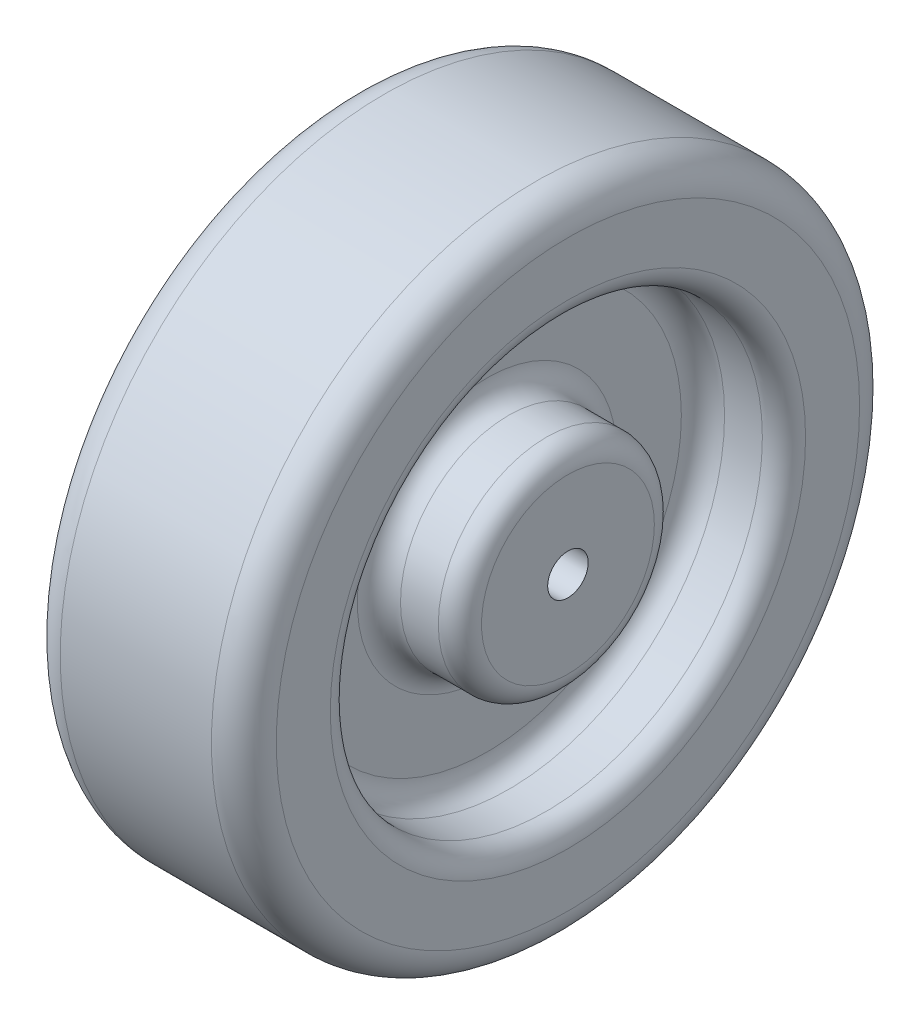
from build123d import *

# Parameters (mm, degrees)
SKETCH1_R           = 76.2
BOSS_EXTRUDE1_DEPTH = 50.8
SKETCH2_R           = 50.8
SKETCH2_R_2         = 25.4
CUT_EXTRUDE1_DEPTH  = 19.05
CUT_EXTRUDE2_START  = -19.05
SKETCH3_R           = 50.8
SKETCH3_R_2         = 25.4
CUT_EXTRUDE2_DEPTH  = 19.05
SKETCH4_R           = 4.7625
CUT_EXTRUDE3_DEPTH  = 120.1365603
FILLET1_R           = 7.62
FILLET2_R           = 5.08


with BuildPart() as part:
    # Sketch1 → Boss-Extrude1 (new body)
    with BuildSketch(Plane(origin=(0, 0, 0), x_dir=(0, 0, -1), z_dir=(1, 0, 0))):
        Circle(SKETCH1_R)
    extrude(amount=BOSS_EXTRUDE1_DEPTH)

    # Sketch2 → Cut-Extrude1 (cut)
    with BuildSketch(Plane(origin=(50.8, 0, 0), x_dir=(0, 0, -1), z_dir=(1, 0, 0))):
        Circle(SKETCH2_R)
        Circle(SKETCH2_R_2, mode=Mode.SUBTRACT)
    extrude(amount=-CUT_EXTRUDE1_DEPTH, mode=Mode.SUBTRACT)

    # Sketch3 → Cut-Extrude2 (cut)
    with BuildSketch(Plane.ZY.offset(CUT_EXTRUDE2_START)):
        Circle(SKETCH3_R)
        Circle(SKETCH3_R_2, mode=Mode.SUBTRACT)
    extrude(amount=CUT_EXTRUDE2_DEPTH, mode=Mode.SUBTRACT)

    # Sketch4 → Cut-Extrude3 (cut, through all)
    with BuildSketch(Plane.ZY):
        Circle(SKETCH4_R)
    extrude(amount=-CUT_EXTRUDE3_DEPTH, mode=Mode.SUBTRACT)

    # Fillet1
    fillet1_edges = [part.edges().sort_by_distance(p)[0] for p in [
        (0, 0, 76.2),
        (50.8, 0, 76.2),
    ]]
    fillet(fillet1_edges, radius=FILLET1_R)

    # Fillet2
    fillet2_edges = [part.edges().sort_by_distance(p)[0] for p in [
        (31.75, 0, 25.4),
        (31.75, 0, 50.8),
        (50.8, 0, 50.8),
        (50.8, 0, 25.4),
        (19.05, 0, -25.4),
        (0, 0, -50.8),
        (19.05, 0, -50.8),
        (0, 0, -25.4),
    ]]
    fillet(fillet2_edges, radius=FILLET2_R)


solid = part.part
